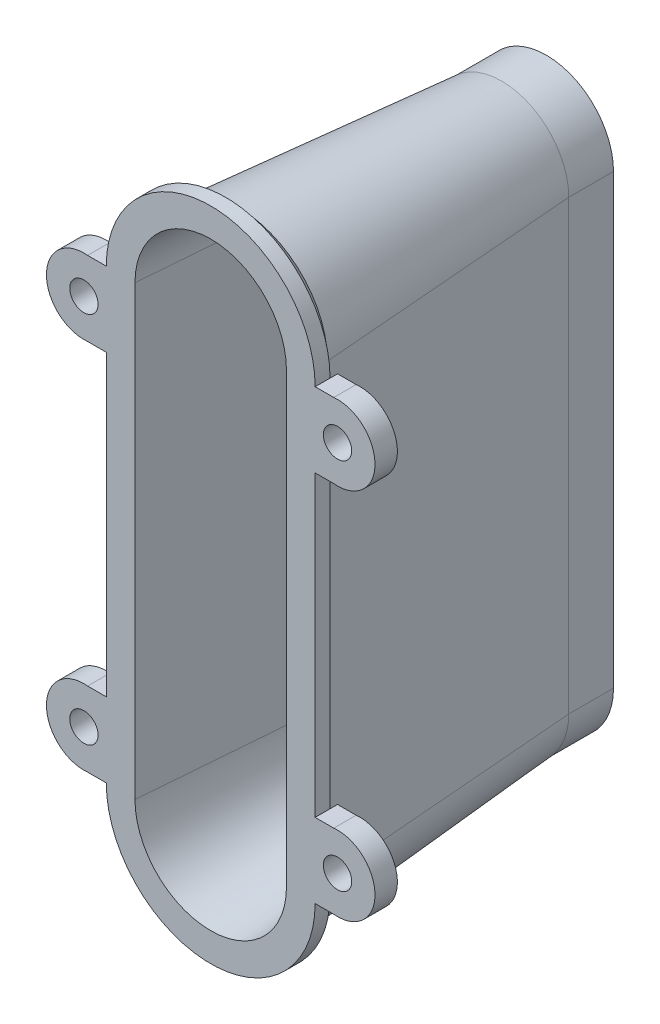
from build123d import *
from OCP.BRepFilletAPI import BRepFilletAPI_MakeChamfer

# Parameters (mm, degrees)
DODANIE_WYCI_GNI_CIE1_DEPTH  = 45
DODANIE_WYCI_GNI_CIE2_DEPTH  = 2
SFAZOWANIE1_SIZE             = 37
SFAZOWANIE1_SIZE2            = 3
SKORUPA4_DEPTH               = 45
SZKIC11_R                    = 1.9
DODANIE_WYCI_GNI_CIE11_DEPTH = 3
SFAZOWANIE6_SIZE             = 1.8
SFAZOWANIE6_SIZE2            = 1.965251773


with BuildPart() as part:
    # Szkic1 → Dodanie-wyciągnięcie1 (new body)
    with BuildSketch(Plane.XY):
        with BuildLine():
            Line((-9, 0), (-9, 60))
            ThreePointArc((-9, 60), (0, 69), (9, 60))
            Line((9, 60), (9, 0))
            ThreePointArc((9, 0), (0, -9), (-9, 0))
        make_face()
    extrude(amount=DODANIE_WYCI_GNI_CIE1_DEPTH)

    # Szkic2 → Dodanie-wyciągnięcie2 (add)
    with BuildSketch(Plane.XY.offset(45)):
        with BuildLine():
            Line((14, 60), (14, 0))
            ThreePointArc((14, 0), (0, -14), (-14, 0))
            Line((-14, 0), (-14, 60))
            ThreePointArc((-14, 60), (0, 74), (14, 60))
        make_face()
    extrude(amount=-DODANIE_WYCI_GNI_CIE2_DEPTH)

    # Sfazowanie1: one chamfer whose edges measure the first distance from different faces: ONE call of the kernel's chamfer builder (chamfer() names one face for all edges)
    sfazowanie1_edges_1 = [part.edges().sort_by_distance(p)[0] for p in [
        (-9, 30, 43),
    ]]
    sfazowanie1_side_1 = [part.faces().sort_by_distance(p)[0] for p in [
        (-9, 30, 21.5),
    ]]
    sfazowanie1_edges_2 = [part.edges().sort_by_distance(p)[0] for p in [
        (0, -9, 43),
    ]]
    sfazowanie1_side_2 = [part.faces().sort_by_distance(p)[0] for p in [
        (0, -9, 21.5),
    ]]
    sfazowanie1_edges_3 = [part.edges().sort_by_distance(p)[0] for p in [
        (9, 30, 43),
    ]]
    sfazowanie1_side_3 = [part.faces().sort_by_distance(p)[0] for p in [
        (9, 30, 21.5),
    ]]
    sfazowanie1_edges_4 = [part.edges().sort_by_distance(p)[0] for p in [
        (0, 69, 43),
    ]]
    sfazowanie1_side_4 = [part.faces().sort_by_distance(p)[0] for p in [
        (0, 69, 21.5),
    ]]
    sfazowanie1 = BRepFilletAPI_MakeChamfer(part.part.solid().wrapped)
    for e in sfazowanie1_edges_1:
        sfazowanie1.Add(SFAZOWANIE1_SIZE, SFAZOWANIE1_SIZE2, e.wrapped, sfazowanie1_side_1[0].wrapped)  # the first distance lies on this face
    for e in sfazowanie1_edges_2:
        sfazowanie1.Add(SFAZOWANIE1_SIZE, SFAZOWANIE1_SIZE2, e.wrapped, sfazowanie1_side_2[0].wrapped)  # the first distance lies on this face
    for e in sfazowanie1_edges_3:
        sfazowanie1.Add(SFAZOWANIE1_SIZE, SFAZOWANIE1_SIZE2, e.wrapped, sfazowanie1_side_3[0].wrapped)  # the first distance lies on this face
    for e in sfazowanie1_edges_4:
        sfazowanie1.Add(SFAZOWANIE1_SIZE, SFAZOWANIE1_SIZE2, e.wrapped, sfazowanie1_side_4[0].wrapped)  # the first distance lies on this face
    add(Compound.cast(sfazowanie1.Shape()), mode=Mode.REPLACE)

    # Skorupa4: read off the stored shape, not the designer's step
    # Skorupa4 outline → Skorupa4 (cut)
    with BuildSketch(Plane.XY):
        with BuildLine():
            ThreePointArc((-7, 0), (0, -7), (7, 0))
            Line((7, 0), (7, 60))
            ThreePointArc((7, 60), (0, 67), (-7, 60))
            Line((-7, 60), (-7, 0))
        make_face()
    extrude(amount=SKORUPA4_DEPTH, mode=Mode.SUBTRACT)

    # Skorupa4 2: loft between two sections, ruled curve by curve
    skorupa4_2_from = [
        Edge.make_three_point_arc((7, 60, 6.080948258), (4.949747468, 64.949747468, 6.080948258), (0, 67, 6.080948258)),
        Edge.make_three_point_arc((0, 67, 6.080948258), (-4.949747468, 64.949747468, 6.080948258), (-7, 60, 6.080948258)),
        Edge.make_three_point_arc((-7, 0, 6.080948258), (-4.949747468, -4.949747468, 6.080948258), (0, -7, 6.080948258)),
        Edge.make_three_point_arc((0, -7, 6.080948258), (4.949747468, -4.949747468, 6.080948258), (7, 0, 6.080948258)),
        Edge.make_line((7, 0, 6.080948258), (7, 60, 6.080948258)),
        Edge.make_line((-7, 60, 6.080948258), (-7, 0, 6.080948258)),
    ]
    skorupa4_2_to = [
        Edge.make_three_point_arc((10.15559879, 60, 45), (7.181092771, 67.181092771, 45), (0, 70.15559879, 45)),
        Edge.make_three_point_arc((0, 70.15559879, 45), (-7.181092771, 67.181092771, 45), (-10.15559879, 60, 45)),
        Edge.make_three_point_arc((-10.15559879, 0, 45), (-7.181092771, -7.181092771, 45), (0, -10.15559879, 45)),
        Edge.make_three_point_arc((0, -10.15559879, 45), (7.181092771, -7.181092771, 45), (10.15559879, 0, 45)),
        Edge.make_line((10.15559879, 0, 45), (10.15559879, 60, 45)),
        Edge.make_line((-10.15559879, 60, 45), (-10.15559879, 0, 45)),
    ]
    skorupa4_2 = Solid(Shell([*[Face.make_surface_from_curves(skorupa4_2_from[k], skorupa4_2_to[k]) for k in range(6)], Face(Wire(skorupa4_2_from)), Face(Wire(skorupa4_2_to))]))
    add(skorupa4_2, mode=Mode.SUBTRACT)

    # Szkic11 → Dodanie-wyciągnięcie11 (add)
    # profile 1 of 4: a face of its own
    with BuildSketch(Plane.XY.offset(45)):
        with BuildLine():
            Line((14, 0), (16.5, 0))
            ThreePointArc((16.5, 0), (22.024937811, 5), (16.5, 10))
            Line((16.5, 10), (14, 10))
            Line((14, 10), (14, 0))
        make_face()
        with Locations((17, 5)):
            Circle(SZKIC11_R, mode=Mode.SUBTRACT)
    # profile 2 of 4: a face of its own
    with BuildSketch(Plane.XY.offset(45)):
        with BuildLine():
            Line((-14, 10), (-16.5, 10))
            ThreePointArc((-16.5, 10), (-22.024937811, 5), (-16.5, 0))
            Line((-16.5, 0), (-14, 0))
            Line((-14, 0), (-14, 10))
        make_face()
        with Locations(Location((-17, 5, 0), (0, 0, 180))):
            Circle(SZKIC11_R, mode=Mode.SUBTRACT)
    # profile 3 of 4: a face of its own
    with BuildSketch(Plane.XY.offset(45)):
        with BuildLine():
            Line((-14, 60), (-16.5, 60))
            ThreePointArc((-16.5, 60), (-22.024937811, 55), (-16.5, 50))
            Line((-16.5, 50), (-14, 50))
            Line((-14, 50), (-14, 60))
        make_face()
        with Locations((-17, 55)):
            Circle(SZKIC11_R, mode=Mode.SUBTRACT)
    # profile 4 of 4: a face of its own
    with BuildSketch(Plane.XY.offset(45)):
        with BuildLine():
            Line((14, 50), (16.5, 50))
            ThreePointArc((16.5, 50), (22.024937811, 55), (16.5, 60))
            Line((16.5, 60), (14, 60))
            Line((14, 60), (14, 50))
        make_face()
        with Locations(Location((17, 55, 0), (0, 0, 180))):
            Circle(SZKIC11_R, mode=Mode.SUBTRACT)
    extrude(amount=-DODANIE_WYCI_GNI_CIE11_DEPTH)

    # Sfazowanie6: one chamfer whose edges measure the first distance from different faces: ONE call of the kernel's chamfer builder (chamfer() names one face for all edges)
    sfazowanie6_edges_1 = [part.edges().sort_by_distance(p)[0] for p in [
        (12, 30, 43),
    ]]
    sfazowanie6_side_1 = [part.faces().sort_by_distance(p)[0] for p in [
        (10.5, 30, 24.5),
    ]]
    sfazowanie6_edges_2 = [part.edges().sort_by_distance(p)[0] for p in [
        (0, 72, 43),
    ]]
    sfazowanie6_side_2 = [part.faces().sort_by_distance(p)[0] for p in [
        (0, 70.5, 24.5),
    ]]
    sfazowanie6_edges_3 = [part.edges().sort_by_distance(p)[0] for p in [
        (0, -12, 43),
    ]]
    sfazowanie6_side_3 = [part.faces().sort_by_distance(p)[0] for p in [
        (0, -10.5, 24.5),
    ]]
    sfazowanie6_edges_4 = [part.edges().sort_by_distance(p)[0] for p in [
        (-12, 30, 43),
    ]]
    sfazowanie6_side_4 = [part.faces().sort_by_distance(p)[0] for p in [
        (-10.5, 30, 24.5),
    ]]
    sfazowanie6 = BRepFilletAPI_MakeChamfer(part.part.solid().wrapped)
    for e in sfazowanie6_edges_1:
        sfazowanie6.Add(SFAZOWANIE6_SIZE, SFAZOWANIE6_SIZE2, e.wrapped, sfazowanie6_side_1[0].wrapped)  # the first distance lies on this face
    for e in sfazowanie6_edges_2:
        sfazowanie6.Add(SFAZOWANIE6_SIZE, SFAZOWANIE6_SIZE2, e.wrapped, sfazowanie6_side_2[0].wrapped)  # the first distance lies on this face
    for e in sfazowanie6_edges_3:
        sfazowanie6.Add(SFAZOWANIE6_SIZE, SFAZOWANIE6_SIZE2, e.wrapped, sfazowanie6_side_3[0].wrapped)  # the first distance lies on this face
    for e in sfazowanie6_edges_4:
        sfazowanie6.Add(SFAZOWANIE6_SIZE, SFAZOWANIE6_SIZE2, e.wrapped, sfazowanie6_side_4[0].wrapped)  # the first distance lies on this face
    add(Compound.cast(sfazowanie6.Shape()), mode=Mode.REPLACE)


solid = part.part
